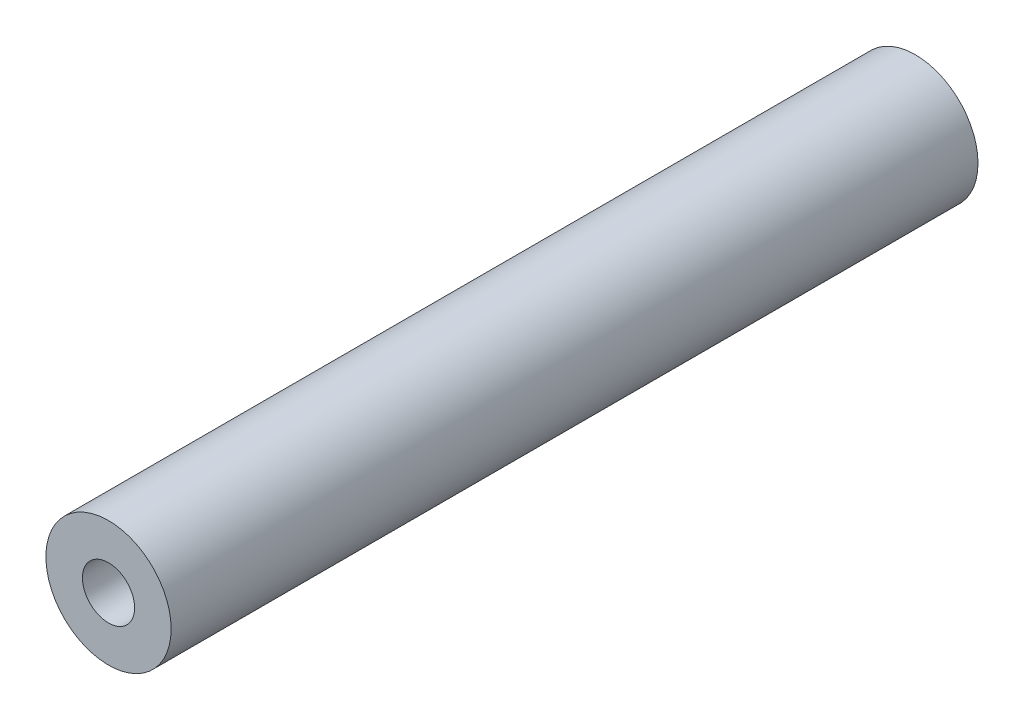
from build123d import *

# Parameters (mm, degrees)
SKETCH_1_R      = 3
SKETCH_1_R_2    = 1.6
EXTRUDE_1_DEPTH = 19.325


# Read off the part's stored shape, not the designer's step: M3x0.5 ねじ穴1
with BuildPart() as part:
    # ｽｹｯﾁ1 → ﾎﾞｽ - 押し出し1 (new, symmetric)
    # profile 1 of 2: a face of its own
    with BuildSketch(Plane.XY):
        Circle(SKETCH_1_R)
        Circle(SKETCH_1_R_2, mode=Mode.SUBTRACT)
    # profile 2 of 2: a face of its own
    with BuildSketch(Plane.XY):
        Circle(SKETCH_1_R_2)
    extrude(amount=EXTRUDE_1_DEPTH, both=True)

    # M3x0.5 ねじ穴1 outline → M3x0.5 ねじ穴1 (revolve, cut)
    with BuildSketch(Plane.XZ):
        Polygon((1.25, -10.825), (0, -10.073924226), (0, -19.325), (1.25, -19.325), align=None)
        Polygon((0, 19.325), (0, 10.073924226), (1.25, 10.825), (1.25, 19.325), align=None)
    revolve(axis=Axis((0, 0, 0), (0, 0, 1)), mode=Mode.SUBTRACT)


solid = part.part
